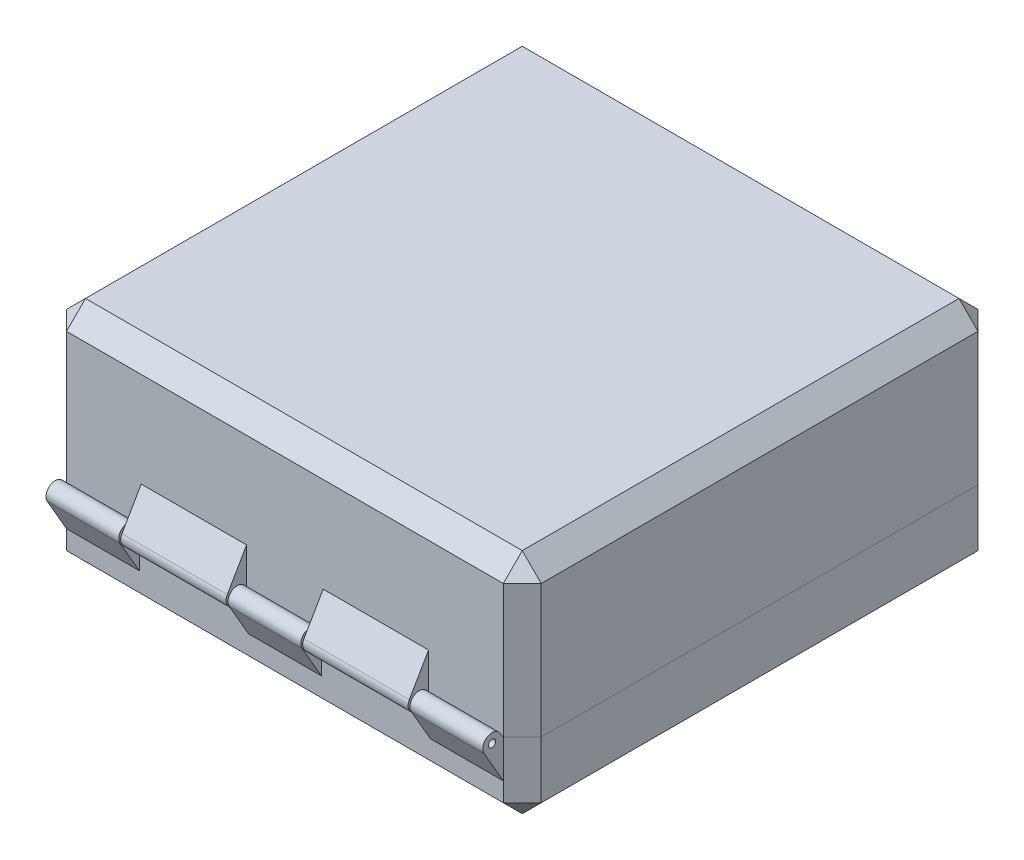
from build123d import *

# Parameters (mm, degrees)
P_IDAT_VYSUNUT_M1_DEPTH       = 1.7
SKICA2_W                      = 49
SKICA2_H                      = 24
P_IDAT_VYSUNUT_M2_DEPTH       = 38
P_IDAT_VYSUNUT_M7_DEPTH       = 25
P_IDAT_VYSUNUT_M5_DEPTH       = 16
P_IDAT_START                  = 31
SKICA3_R                      = 22
P_IDAT_VYSUNUT_M3_DEPTH       = 10.5
SKICA4_R                      = 6
P_IDAT_VYSUNUT_M4_DEPTH       = 41.5
P_IDAT_START_2                = 10
P_IDAT_VYSUNUT_M6_DEPTH       = 10
P_IDAT_VYSUNUT_M8_DEPTH       = 20
P_IDAT_VYSUNUT_M8_DEPTH_BACK  = 40
SKICA9_W                      = 125
SKICA9_H                      = 125
ZKOSEN_1_SIZE                 = 5
ODEBRAT_VYSUNUT_M2_DEPTH      = 16
ODEBRAT_VYSUNUT_M2_DEPTH_BACK = 5
ODEBRAT_START                 = -14.3
ODEBRAT_VYSUNUT_M3_DEPTH      = 52
P_IDAT_VYSUNUT_M9_DEPTH       = 74.5
P_IDAT_VYSUNUT_M9_DEPTH_BACK  = 40.5
SKICA16_R                     = 0.95
SKICA19_W                     = 28.75
SKICA19_H                     = 20.414879198
ODEBRAT_VYSUNUT_M5_DEPTH      = 123.11335922
P_IDAT_VYSUNUT_M10_DEPTH      = 54.833333
P_IDAT_VYSUNUT_M10_DEPTH_BACK = 20.833333
SKICA20_R                     = 1.05
SKICA21_W                     = 20.166666666
SKICA21_H                     = 5.4
ODEBRAT_VYSUNUT_M6_DEPTH      = 123.11335922
SKICA23_R                     = 1.05
P_IDAT_VYSUNUT_M11_DEPTH      = 10
SKICA24_R                     = 0.95
SKICA24_R_2                   = 1.05
P_IDAT_VYSUNUT_M12_DEPTH      = 20
ODEBRAT_VYSUNUT_M7_DEPTH      = 10.5
ODEBRAT_VYSUNUT_M7_DEPTH_BACK = 10.5
P_IDAT_VYSUNUT_M13_DEPTH      = 25
P_IDAT_VYSUNUT_M13_DEPTH_BACK = 25
SKICA26_R                     = 0.95
ODEBRAT_VYSUNUT_M8_DEPTH      = 20.5
ODEBRAT_VYSUNUT_M8_DEPTH_BACK = 20.5
SKICA29_W                     = 36
SKICA29_H                     = 4.234017921
ODEBRAT_VYSUNUT_M10_DEPTH     = 114.629540613
ODEBRAT_START_2               = 0.5
ODEBRAT_VYSUNUT_M11_DEPTH     = 8
ODEBRAT_VYSUNUT_M12_DEPTH     = 8


# Read off the part's stored shape, not the designer's step: Rozdělit1
with BuildPart() as part:
    # Skica1 → Přidat vysunutím1 (new body)
    with BuildSketch(Plane(origin=(0, 0, 0), x_dir=(1, 0, 0), z_dir=(0, 1, 0))):
        with BuildLine():
            Line((-42, 27.082039325), (-42, -2.254033308))
            ThreePointArc((-42, -2.254033308), (-35.101020514, -3.67544468), (-32, -10))
            Line((-32, -10), (-32, -52))
            Line((-32, -52), (32, -52))
            Line((32, -52), (32, -10))
            ThreePointArc((32, -10), (35.101020514, -3.67544468), (42, -2.254033308))
            Line((42, -2.254033308), (42, 27.082039325))
            ThreePointArc((42, 27.082039325), (37.639241966, 40.229554028), (26.285714286, 48.16496597))
            ThreePointArc((26.285714286, 48.16496597), (0, 52), (-26.285714286, 48.16496597))
            ThreePointArc((-26.285714286, 48.16496597), (-37.639241966, 40.229554028), (-42, 27.082039325))
        make_face()
    extrude(amount=P_IDAT_VYSUNUT_M1_DEPTH)

    # Skica2 → Přidat vysunutím2 (add)
    with BuildSketch(Plane(origin=(0, 1.7, 0), x_dir=(1, 0, 0), z_dir=(0, 1, 0))):
        with Locations((0, 28)):
            Rectangle(SKICA2_W, SKICA2_H)
    extrude(amount=P_IDAT_VYSUNUT_M2_DEPTH)

    # Skica8 → Přidat vysunutím7 (add)
    with BuildSketch(Plane(origin=(0, 1.7, 0), x_dir=(1, 0, 0), z_dir=(0, 1, 0))):
        Polygon((-29.5, -30), (-12, -30), (-12, -42), (12, -42), (12, -30), (29.5, -30), (29.5, 2), (-29.5, 2), align=None)
    extrude(amount=P_IDAT_VYSUNUT_M7_DEPTH)

    # Skica6 → Přidat vysunutím5 (add)
    with BuildSketch(Plane(origin=(0, 1.7, 0), x_dir=(1, 0, 0), z_dir=(0, 1, 0))):
        with BuildLine():
            Line((-42, 15), (-37, 15))
            ThreePointArc((-37, 15), (-33.464466094, 13.535533906), (-32, 10))
            Line((-32, 10), (-32, 8))
            ThreePointArc((-32, 8), (-33.464466094, 4.464466094), (-37, 3))
            Line((-37, 3), (-42, 3))
            Line((-42, 3), (-42, -2.254033308))
            ThreePointArc((-42, -2.254033308), (-35.101020514, -3.67544468), (-32, -10))
            Line((-32, -10), (-32, -52))
            Line((-32, -52), (-6, -52))
            Line((-6, -52), (-6, -47))
            ThreePointArc((-6, -47), (-4.535533906, -43.464466094), (-1, -42))
            Line((-1, -42), (1, -42))
            ThreePointArc((1, -42), (4.535533906, -43.464466094), (6, -47))
            Line((6, -47), (6, -52))
            Line((6, -52), (32, -52))
            Line((32, -52), (32, -10))
            ThreePointArc((32, -10), (35.101020514, -3.67544468), (42, -2.254033308))
            Line((42, -2.254033308), (42, 3))
            Line((42, 3), (37, 3))
            ThreePointArc((37, 3), (33.464466094, 4.464466094), (32, 8))
            Line((32, 8), (32, 10))
            ThreePointArc((32, 10), (33.464466094, 13.535533906), (37, 15))
            Line((37, 15), (42, 15))
            Line((42, 15), (42, 27.082039325))
            ThreePointArc((42, 27.082039325), (37.639241966, 40.229554028), (26.285714286, 48.16496597))
            ThreePointArc((26.285714286, 48.16496597), (0, 52), (-26.285714286, 48.16496597))
            ThreePointArc((-26.285714286, 48.16496597), (-37.639241966, 40.229554028), (-42, 27.082039325))
            Line((-42, 27.082039325), (-42, 15))
        make_face()
    extrude(amount=P_IDAT_VYSUNUT_M5_DEPTH)

    # Skica3 → Přidat vysunutím3 (add)
    with BuildSketch(Plane(origin=(0, 0, 0), x_dir=(0, 0, -1), z_dir=(1, 0, 0)).offset(P_IDAT_START)):
        with Locations(Location((-35.5, 6, 0), (0, 0, 32.128384554))):
            Circle(SKICA3_R)
    p_idat_vysunut_m3 = extrude(amount=P_IDAT_VYSUNUT_M3_DEPTH)

    # Skica4 → Přidat vysunutím4 (add)
    with BuildSketch(Plane(origin=(0, 0, 0), x_dir=(0, 0, -1), z_dir=(1, 0, 0))):
        with Locations((-35.5, 6)):
            Circle(SKICA4_R)
    p_idat_vysunut_m4 = extrude(amount=P_IDAT_VYSUNUT_M4_DEPTH)

    # Zrcadlit2: Přidat vysunutím3, Přidat vysunutím4 across plane
    add(p_idat_vysunut_m3.mirror(Plane(origin=(0, 0, 0), x_dir=(0, 0, 1), z_dir=(1, 0, 0))))
    add(p_idat_vysunut_m4.mirror(Plane(origin=(0, 0, 0), x_dir=(0, 0, 1), z_dir=(1, 0, 0))))

    # Skica7 → Přidat vysunutím6 (add)
    with BuildSketch(Plane.XZ.offset(P_IDAT_START_2)):
        with BuildLine():
            Line((-42, -3), (-37, -3))
            ThreePointArc((-37, -3), (-33.464466094, -4.464466094), (-32, -8))
            Line((-32, -8), (-32, -10))
            ThreePointArc((-32, -10), (-33.464466094, -13.535533906), (-37, -15))
            Line((-37, -15), (-42, -15))
            Line((-42, -15), (-42, -27.082039325))
            ThreePointArc((-42, -27.082039325), (-37.639241966, -40.229554028), (-26.285714286, -48.16496597))
            ThreePointArc((-26.285714286, -48.16496597), (0, -52), (26.285714286, -48.16496597))
            ThreePointArc((26.285714286, -48.16496597), (37.639241966, -40.229554028), (42, -27.082039325))
            Line((42, -27.082039325), (42, -15))
            Line((42, -15), (37, -15))
            ThreePointArc((37, -15), (33.464466094, -13.535533906), (32, -10))
            Line((32, -10), (32, -8))
            ThreePointArc((32, -8), (33.464466094, -4.464466094), (37, -3))
            Line((37, -3), (42, -3))
            Line((42, -3), (42, 2.254033308))
            ThreePointArc((42, 2.254033308), (35.101020514, 3.67544468), (32, 10))
            Line((32, 10), (32, 52))
            Line((32, 52), (6, 52))
            Line((6, 52), (6, 47))
            ThreePointArc((6, 47), (4.535533906, 43.464466094), (1, 42))
            Line((1, 42), (-1, 42))
            ThreePointArc((-1, 42), (-4.535533906, 43.464466094), (-6, 47))
            Line((-6, 47), (-6, 52))
            Line((-6, 52), (-32, 52))
            Line((-32, 52), (-32, 10))
            ThreePointArc((-32, 10), (-35.101020514, 3.67544468), (-42, 2.254033308))
            Line((-42, 2.254033308), (-42, -3))
        make_face()
    extrude(amount=-P_IDAT_VYSUNUT_M6_DEPTH)


with BuildPart() as body_2:
    # Skica9 → Přidat vysunutím8 (new, two sides: drawn at the far end of the back side and taken through both)
    with BuildSketch(Plane.XZ.offset(-1.7).offset(-P_IDAT_VYSUNUT_M8_DEPTH_BACK)):
        with Locations((17, 2.75)):
            Rectangle(SKICA9_W, SKICA9_H)
    extrude(amount=P_IDAT_VYSUNUT_M8_DEPTH + P_IDAT_VYSUNUT_M8_DEPTH_BACK)

    # Zkosení1
    zkosen_1_edges = [body_2.edges().sort_by_distance(p)[0] for p in [
        (79.5, 41.7, 2.75),
        (-45.5, -18.3, 2.75),
        (17, -18.3, -59.75),
        (17, 41.7, 65.25),
        (79.5, -18.3, 2.75),
        (17, -18.3, 65.25),
        (-45.5, 41.7, 2.75),
        (17, 41.7, -59.75),
        (-45.5, 11.7, 65.25),
        (79.5, 11.7, 65.25),
        (79.5, 11.7, -59.75),
        (-45.5, 11.7, -59.75),
    ]]
    chamfer(zkosen_1_edges, length=ZKOSEN_1_SIZE)

    # Kombinovat1: cut part
    add(part.part, mode=Mode.SUBTRACT)

    # Skica11 → Odebrat vysunutím2 (cut, two sides: drawn at the far end of the back side and taken through both)
    with BuildSketch(Plane.XZ.offset(-1.7).offset(-ODEBRAT_VYSUNUT_M2_DEPTH_BACK)):
        Polygon((75.5, 6.25), (45.5, 6.25), (45.5, 61.25), (72.843145751, 61.25), (75.5, 58.593145751), align=None)
    extrude(amount=ODEBRAT_VYSUNUT_M2_DEPTH + ODEBRAT_VYSUNUT_M2_DEPTH_BACK, mode=Mode.SUBTRACT)

    # Skica14 → Odebrat vysunutím3 (cut)
    with BuildSketch(Plane(origin=(0, 0, 0), x_dir=(1, 0, 0), z_dir=(0, 1, 0)).offset(ODEBRAT_START)):
        Polygon((46, -2.25), (46, 55.75), (72.843145751, 55.75), (75.5, 53.093145751), (75.5, -2.25), align=None)
    extrude(amount=ODEBRAT_VYSUNUT_M3_DEPTH, mode=Mode.SUBTRACT)


with BuildPart() as body_2_2:
    # Rozdělit1: the piece on the far side of the plane
    add(body_2.part)
    split(bisect_by=Plane(origin=(0, 1.7, 0), x_dir=(1, 0, 0), z_dir=(0, 1, 0)), keep=Keep.BOTTOM)

    # Skica16 → Přidat vysunutím9 (add, two sides: drawn at the far end of the back side and taken through both)
    with BuildSketch(Plane(origin=(0, 0, 0), x_dir=(0, 0, -1), z_dir=(1, 0, 0)).offset(-P_IDAT_VYSUNUT_M9_DEPTH_BACK)):
        with BuildLine():
            Line((-70.321184847, 0.47400047), (-65.25, -8.3))
            Line((-65.25, -8.3), (-65.25, 1.7))
            Line((-65.25, 1.7), (-66.165254237, 3.064664677))
            ThreePointArc((-66.165254237, 3.064664677), (-69.496052926, 3.779121645), (-70.321184847, 0.47400047))
        make_face()
        with Locations((-68.2, 1.7)):
            Circle(SKICA16_R, mode=Mode.SUBTRACT)
    extrude(amount=P_IDAT_VYSUNUT_M9_DEPTH + P_IDAT_VYSUNUT_M9_DEPTH_BACK)

    # Skica19 → Odebrat vysunutím5 (cut, through all)
    with BuildSketch(Plane.XZ.offset(18.3)):
        with Locations((-6.958333333, 75.457439599)):
            Rectangle(SKICA19_W, SKICA19_H)
        with Locations((40.958333333, 75.457439599)):
            Rectangle(SKICA19_W, SKICA19_H)
    extrude(amount=-ODEBRAT_VYSUNUT_M5_DEPTH, mode=Mode.SUBTRACT)

    # Skica23 → Přidat vysunutím11 (add, symmetric)
    with BuildSketch(Plane(origin=(17, 0, 0), x_dir=(0, 0, -1), z_dir=(1, 0, 0))):
        with BuildLine():
            Line((59.75, 1.7), (60.665254237, 3.064664677))
            ThreePointArc((60.665254237, 3.064664677), (63.996052926, 3.779121645), (64.821184847, 0.47400047))
            Line((64.821184847, 0.47400047), (59.75, -8.3))
            Line((59.75, -8.3), (59.75, 1.7))
        make_face()
        with Locations((62.7, 1.7)):
            Circle(SKICA23_R, mode=Mode.SUBTRACT)
    extrude(amount=P_IDAT_VYSUNUT_M11_DEPTH, both=True)


with BuildPart() as body_2_1:
    add(body_2.part)

    # Rozdělit1
    split(bisect_by=Plane(origin=(0, 1.7, 0), x_dir=(1, 0, 0), z_dir=(0, 1, 0)), keep=Keep.TOP)

    # Skica20 → Přidat vysunutím10 (add, two sides: drawn at the far end of the back side and taken through both)
    with BuildSketch(Plane(origin=(0, 0, 0), x_dir=(0, 0, -1), z_dir=(1, 0, 0)).offset(-P_IDAT_VYSUNUT_M10_DEPTH_BACK)):
        with BuildLine():
            Line((-70.321184847, 2.92599953), (-65.25, 11.7))
            Line((-65.25, 11.7), (-65.25, 1.7))
            Line((-65.25, 1.7), (-66.165254237, 0.335335323))
            ThreePointArc((-66.165254237, 0.335335323), (-69.496052926, -0.379121645), (-70.321184847, 2.92599953))
        make_face()
        with Locations(Location((-68.2, 1.7, 0), (0, 0, 180))):
            Circle(SKICA20_R, mode=Mode.SUBTRACT)
    extrude(amount=P_IDAT_VYSUNUT_M10_DEPTH + P_IDAT_VYSUNUT_M10_DEPTH_BACK)

    # Skica21 → Odebrat vysunutím6 (cut, through all)
    with BuildSketch(Plane.XZ.offset(18.3)):
        with Locations((17, 67.95)):
            Rectangle(SKICA21_W, SKICA21_H)
    extrude(amount=-ODEBRAT_VYSUNUT_M6_DEPTH, mode=Mode.SUBTRACT)

    # Skica30 → Odebrat vysunutím11 (cut)
    with BuildSketch(Plane.ZY.offset(-35).offset(ODEBRAT_START_2)):
        with BuildLine():
            Line((-59.75, 20.717191695), (-59.75, 13.364313481))
            Line((-59.75, 13.364313481), (-57.739266802, 13.364313481))
            ThreePointArc((-57.739266802, 13.364313481), (-57.432715427, 13.304506123), (-57.171125704, 13.133855948))
            ThreePointArc((-57.171125704, 13.133855948), (-56.75, 12.864313481), (-56.256925711, 12.781381305))
            ThreePointArc((-56.256925711, 12.781381305), (-55.528787326, 13.105449594), (-55.230192806, 13.844399576))
            ThreePointArc((-55.230192806, 13.844399576), (-56.461401901, 17.957303921), (-59.75, 20.717191695))
        make_face()
    extrude(amount=-ODEBRAT_VYSUNUT_M11_DEPTH, mode=Mode.SUBTRACT)

    # Skica31 → Odebrat vysunutím12 (cut)
    with BuildSketch(Plane(origin=(-1, 0, 0), x_dir=(0, 0, -1), z_dir=(1, 0, 0)).offset(ODEBRAT_START_2)):
        with BuildLine():
            Line((59.75, 13.364313481), (59.75, 20.717191695))
            ThreePointArc((59.75, 20.717191695), (56.461401901, 17.957303921), (55.230192806, 13.844399576))
            ThreePointArc((55.230192806, 13.844399576), (55.528787326, 13.105449594), (56.256925711, 12.781381305))
            ThreePointArc((56.256925711, 12.781381305), (56.75, 12.864313481), (57.171125704, 13.133855948))
            ThreePointArc((57.171125704, 13.133855948), (57.432715427, 13.304506123), (57.739266802, 13.364313481))
            Line((57.739266802, 13.364313481), (59.75, 13.364313481))
        make_face()
    extrude(amount=-ODEBRAT_VYSUNUT_M12_DEPTH, mode=Mode.SUBTRACT)


with BuildPart() as body_3:
    # Skica24 → Přidat vysunutím12 (new, symmetric)
    with BuildSketch(Plane.ZY.offset(-17)):
        with BuildLine():
            Line((-65.15, 1.7), (-65.15, -14))
            ThreePointArc((-65.15, -14), (-64.446783715, -14.748539434), (-63.655836576, -14.093385214))
            ThreePointArc((-63.655836576, -14.093385214), (-63.337362177, -13.490989533), (-62.7, -13.25))
            ThreePointArc((-62.7, -13.25), (-61.546945027, -12.961704011), (-60.665254237, -12.164664677))
            Line((-60.665254237, -12.164664677), (-59.75, -10.8))
            Line((-59.75, -10.8), (-59.75, 1.7))
            Line((-59.75, 1.7), (-60.665254237, 3.064664677))
            ThreePointArc((-60.665254237, 3.064664677), (-63.413222574, 4.043888555), (-65.15, 1.7))
        make_face()
        with Locations((-62.7, 1.7)):
            Circle(SKICA24_R, mode=Mode.SUBTRACT)
        with Locations((-62.7, -10.8)):
            Circle(SKICA24_R_2, mode=Mode.SUBTRACT)
    extrude(amount=P_IDAT_VYSUNUT_M12_DEPTH, both=True)

    # Skica25 → Odebrat vysunutím7 (cut, two sides: drawn at the far end of the back side and taken through both)
    with BuildSketch(Plane.ZY.offset(-17).offset(-ODEBRAT_VYSUNUT_M7_DEPTH_BACK)):
        with BuildLine():
            Line((-59.25, -10.164268597), (-59.25, 1.852145155))
            Line((-59.25, 1.852145155), (-60.25, 3.343167673))
            ThreePointArc((-60.25, 3.343167673), (-64.260553523, 4.203432184), (-65.254079713, 0.223796485))
            Line((-65.254079713, 0.223796485), (-59.25, -10.164268597))
        make_face()
    extrude(amount=ODEBRAT_VYSUNUT_M7_DEPTH + ODEBRAT_VYSUNUT_M7_DEPTH_BACK, mode=Mode.SUBTRACT)


with BuildPart() as body_4:
    # Skica26 → Přidat vysunutím13 (new, two sides: drawn at the far end of the back side and taken through both)
    with BuildSketch(Plane.ZY.offset(-17).offset(-P_IDAT_VYSUNUT_M13_DEPTH_BACK)):
        with BuildLine():
            Line((-65.15, -10.8), (-65.15, 15.864313481))
            ThreePointArc((-65.15, 15.864313481), (-64.432411614, 17.596725095), (-62.7, 18.314313481))
            ThreePointArc((-62.7, 18.314313481), (-58.59674885, 17.108733713), (-55.797757443, 13.875200091))
            ThreePointArc((-55.797757443, 13.875200091), (-56.052659981, 12.94789133), (-57.010522892, 13.03377199))
            Line((-57.010522892, 13.03377199), (-57.34215748, 13.365406579))
            ThreePointArc((-57.34215748, 13.365406579), (-59.19847857, 13.734651801), (-60.25, 12.16093877))
            Line((-60.25, 12.16093877), (-60.25, -10.8))
            ThreePointArc((-60.25, -10.8), (-62.7, -13.25), (-65.15, -10.8))
        make_face()
        with Locations((-62.7, -10.8)):
            Circle(SKICA26_R, mode=Mode.SUBTRACT)
    extrude(amount=P_IDAT_VYSUNUT_M13_DEPTH + P_IDAT_VYSUNUT_M13_DEPTH_BACK)

    # Skica27 → Odebrat vysunutím8 (cut, two sides: drawn at the far end of the back side and taken through both)
    with BuildSketch(Plane.ZY.offset(-17).offset(-ODEBRAT_VYSUNUT_M8_DEPTH_BACK)):
        with BuildLine():
            Line((-59.25, 9.321930009), (-64.785965005, 3.785965005))
            ThreePointArc((-64.785965005, 3.785965005), (-65.425444621, 2.828916125), (-65.65, 1.7))
            Line((-65.65, 1.7), (-65.65, -14))
            ThreePointArc((-65.65, -14), (-64.477972858, -15.247565723), (-63.159727626, -14.155642023))
            ThreePointArc((-63.159727626, -14.155642023), (-63.006551359, -13.86590846), (-62.7, -13.75))
            ThreePointArc((-62.7, -13.75), (-61.311627686, -13.402868094), (-60.25, -12.443167673))
            Line((-60.25, -12.443167673), (-59.25, -10.952145155))
            Line((-59.25, -10.952145155), (-59.25, 9.321930009))
        make_face()
    extrude(amount=ODEBRAT_VYSUNUT_M8_DEPTH + ODEBRAT_VYSUNUT_M8_DEPTH_BACK, mode=Mode.SUBTRACT)

    # Skica29 → Odebrat vysunutím10 (cut, through all)
    with BuildSketch(Plane(origin=(0, 1.7, 0), x_dir=(1, 0, 0), z_dir=(0, 1, 0))):
        with Locations((17, 57.63299104)):
            Rectangle(SKICA29_W, SKICA29_H)
    extrude(amount=ODEBRAT_VYSUNUT_M10_DEPTH, mode=Mode.SUBTRACT)


solid = Compound([body_2_2.part, body_2_1.part, body_3.part, body_4.part])
